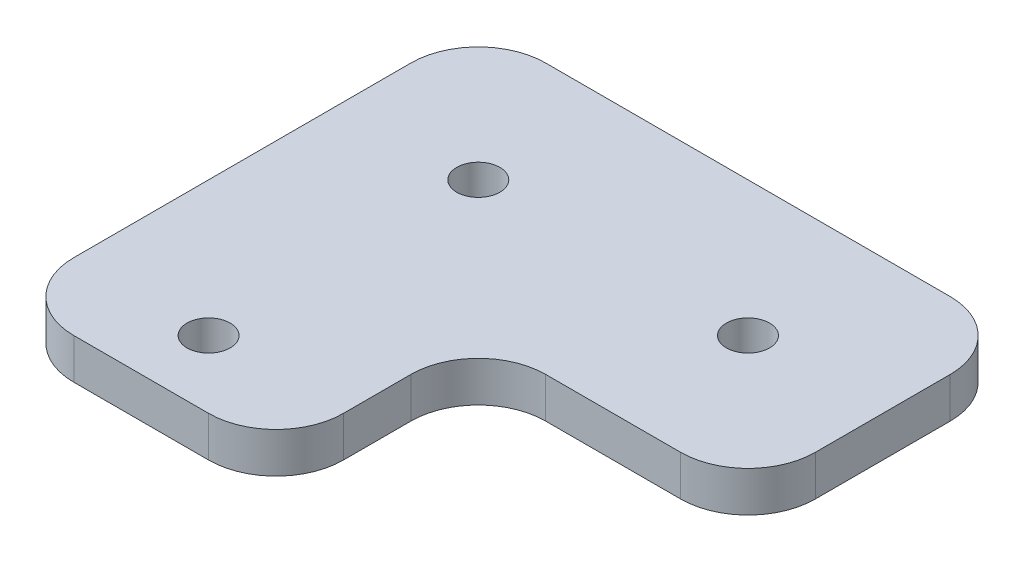
from build123d import *

# Parameters (mm, degrees)
SKETCH_1_R      = 1.6
EXTRUDE_1_DEPTH = 3
FILLET_1_R      = 5


with BuildPart() as part:
    # 草图1 → 凸台-拉伸1 (new body)
    with BuildSketch(Plane(origin=(0, 0, 0), x_dir=(1, 0, 0), z_dir=(0, 1, 0))):
        Polygon((0, 0), (0, 35), (40, 35), (40, 15), (20, 15), (20, 0), align=None)
        with Locations((30, 25)):
            Circle(SKETCH_1_R, mode=Mode.SUBTRACT)
        with Locations((10, 25)):
            Circle(SKETCH_1_R, mode=Mode.SUBTRACT)
        with Locations((10, 5)):
            Circle(SKETCH_1_R, mode=Mode.SUBTRACT)
    extrude(amount=EXTRUDE_1_DEPTH)

    # 圆角1
    fillet_1_edges = [part.edges().sort_by_distance(p)[0] for p in [
        (0, 1.5, 0),
        (20, 1.5, 0),
        (40, 1.5, -15),
        (40, 1.5, -35),
        (0, 1.5, -35),
        (20, 1.5, -15),
    ]]
    fillet(fillet_1_edges, radius=FILLET_1_R)


solid = part.part
